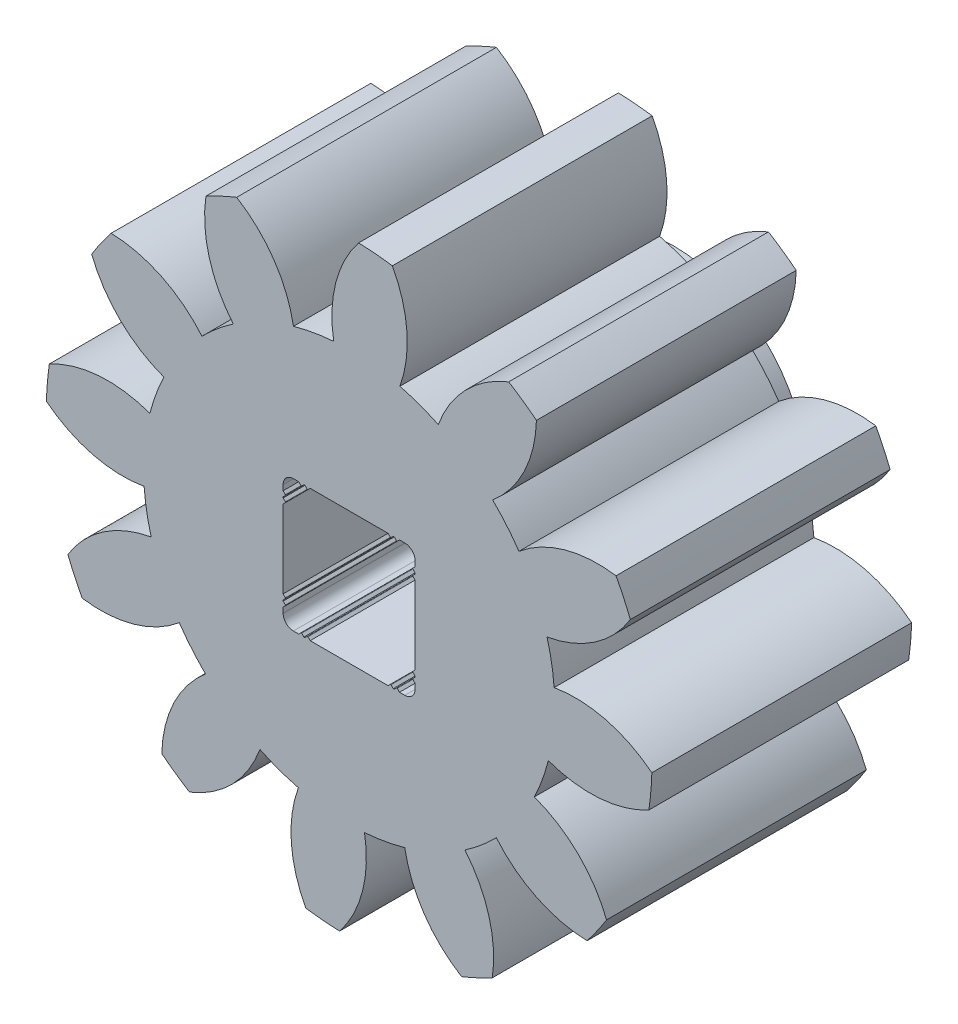
from build123d import *

# Parameters (mm, degrees)
SKETCH1_W            = 7.404
SKETCH1_H            = 6.35
CUT_EXTRUDE1_DEPTH   = 13.245853666
CUT_EXTRUDE2_DEPTH   = 13.245853666
CUT_EXTRUDE3_DEPTH   = 13.245853666
CUT_EXTRUDE4_DEPTH   = 13.245853666
CUT_EXTRUDE5_DEPTH   = 13.245853666
CUT_EXTRUDE6_DEPTH   = 13.245853666
CUT_EXTRUDE7_DEPTH   = 13.245853666
CUT_EXTRUDE8_DEPTH   = 13.245853666
CUT_EXTRUDE9_DEPTH   = 13.243663808
CUT_EXTRUDE10_DEPTH  = 13.243663808
CUT_EXTRUDE11_DEPTH  = 13.243663808
CUT_EXTRUDE12_DEPTH  = 13.241473559
SKETCH15_R           = 3.25
BOSS_EXTRUDE2_DEPTH  = 1.5875
CUT_EXTRUDE13_DEPTH  = 14.135260985
FILLET1_R            = 0.0127
CHAMFER1_SIZE        = 0.017960512
CHAMFER2_SIZE        = 0.017990274
CHAMFER2_PART_2_SIZE = 0.017990274
CHAMFER2_PART_3_SIZE = 0.017990274
CHAMFER2_PART_4_SIZE = 0.017990274
FILLET2_R            = 0.25


with BuildPart() as part:
    # Sketch1 → Revolve1 (revolve)
    with BuildSketch(Plane(origin=(0, 0, 0), x_dir=(1, 0, 0), z_dir=(0, 1, 0))):
        with Locations((3.702, 0)):
            Rectangle(SKETCH1_W, SKETCH1_H)
    revolve(axis=Axis((0, 0, -3.175), (0, 0, 1)))

    # Sketch2 → Cut-Extrude1 (cut, through all)
    with BuildSketch(Plane(origin=(0, 0, -3.175), x_dir=(-1, 0, 0), z_dir=(0, 0, -1))):
        with BuildLine():
            ThreePointArc((1.057001873, -7.328162323), (2.532317141, -6.957484164), (3.900741532, -6.293125734))
            ThreePointArc((3.900741532, -6.293125734), (2.850773823, -5.595435975), (2.180140266, -4.527983952))
            ThreePointArc((2.180140266, -4.527983952), (1.71882223, -4.722425266), (1.240447645, -4.870004095))
            ThreePointArc((1.240447645, -4.870004095), (1.41285747, -6.118794727), (1.057001873, -7.328162323))
        make_face()
    extrude(amount=-CUT_EXTRUDE1_DEPTH, mode=Mode.SUBTRACT)

    # Sketch3 → Cut-Extrude2 (cut, through all)
    with BuildSketch(Plane(origin=(0, 0, -3.175), x_dir=(-1, 0, 0), z_dir=(0, 0, -1))):
        with BuildLine():
            ThreePointArc((-2.748690687, -6.874875672), (-1.285691107, -7.291516603), (0.231578393, -7.400377521))
            ThreePointArc((0.231578393, -7.400377521), (-0.328875436, -6.271176611), (-0.375935122, -5.011419263))
            ThreePointArc((-0.375935122, -5.011419263), (-0.872668917, -4.949151363), (-1.360742875, -4.837771086))
            ThreePointArc((-1.360742875, -4.837771086), (-1.835826903, -6.005460409), (-2.748690687, -6.874875672))
        make_face()
    extrude(amount=-CUT_EXTRUDE2_DEPTH, mode=Mode.SUBTRACT)

    # Sketch4 → Cut-Extrude3 (cut, through all)
    with BuildSketch(Plane(origin=(0, 0, -3.175), x_dir=(-1, 0, 0), z_dir=(0, 0, -1))):
        with BuildLine():
            ThreePointArc((-5.817873798, -4.579471636), (-4.759199462, -5.671793057), (-3.499635989, -6.524704127))
            ThreePointArc((-3.499635989, -6.524704127), (-3.420402788, -5.266560539), (-2.831278997, -4.15204883))
            ThreePointArc((-2.831278997, -4.15204883), (-3.230329132, -3.849756349), (-3.597323441, -3.509261221))
            ThreePointArc((-3.597323441, -3.509261221), (-4.592602939, -4.282967824), (-5.817873798, -4.579471636))
        make_face()
    extrude(amount=-CUT_EXTRUDE3_DEPTH, mode=Mode.SUBTRACT)

    # Sketch5 → Cut-Extrude4 (cut, through all)
    with BuildSketch(Plane(origin=(0, 0, -3.175), x_dir=(-1, 0, 0), z_dir=(0, 0, -1))):
        with BuildLine():
            ThreePointArc((-7.328162323, -1.057001873), (-6.957484164, -2.532317141), (-6.293125734, -3.900741532))
            ThreePointArc((-6.293125734, -3.900741532), (-5.595435975, -2.850773823), (-4.527983952, -2.180140266))
            ThreePointArc((-4.527983952, -2.180140266), (-4.722425266, -1.71882223), (-4.870004095, -1.240447645))
            ThreePointArc((-4.870004095, -1.240447645), (-6.118794727, -1.41285747), (-7.328162323, -1.057001873))
        make_face()
    extrude(amount=-CUT_EXTRUDE4_DEPTH, mode=Mode.SUBTRACT)

    # Sketch6 → Cut-Extrude5 (cut, through all)
    with BuildSketch(Plane(origin=(0, 0, -3.175), x_dir=(-1, 0, 0), z_dir=(0, 0, -1))):
        with BuildLine():
            ThreePointArc((-6.874875672, 2.748690687), (-7.291516603, 1.285691107), (-7.400377521, -0.231578393))
            ThreePointArc((-7.400377521, -0.231578393), (-6.271176611, 0.328875436), (-5.011419263, 0.375935122))
            ThreePointArc((-5.011419263, 0.375935122), (-4.949151363, 0.872668917), (-4.837771086, 1.360742875))
            ThreePointArc((-4.837771086, 1.360742875), (-6.005460409, 1.835826903), (-6.874875672, 2.748690687))
        make_face()
    extrude(amount=-CUT_EXTRUDE5_DEPTH, mode=Mode.SUBTRACT)

    # Sketch7 → Cut-Extrude6 (cut, through all)
    with BuildSketch(Plane(origin=(0, 0, -3.175), x_dir=(-1, 0, 0), z_dir=(0, 0, -1))):
        with BuildLine():
            ThreePointArc((-4.579471636, 5.817873798), (-5.671793057, 4.759199462), (-6.524704127, 3.499635989))
            ThreePointArc((-6.524704127, 3.499635989), (-5.266560539, 3.420402788), (-4.15204883, 2.831278997))
            ThreePointArc((-4.15204883, 2.831278997), (-3.849756349, 3.230329132), (-3.509261221, 3.597323441))
            ThreePointArc((-3.509261221, 3.597323441), (-4.282967824, 4.592602939), (-4.579471636, 5.817873798))
        make_face()
    extrude(amount=-CUT_EXTRUDE6_DEPTH, mode=Mode.SUBTRACT)

    # Sketch8 → Cut-Extrude7 (cut, through all)
    with BuildSketch(Plane(origin=(0, 0, -3.175), x_dir=(-1, 0, 0), z_dir=(0, 0, -1))):
        with BuildLine():
            ThreePointArc((-1.057001873, 7.328162323), (-2.532317141, 6.957484164), (-3.900741532, 6.293125734))
            ThreePointArc((-3.900741532, 6.293125734), (-2.850773823, 5.595435975), (-2.180140266, 4.527983952))
            ThreePointArc((-2.180140266, 4.527983952), (-1.71882223, 4.722425266), (-1.240447645, 4.870004095))
            ThreePointArc((-1.240447645, 4.870004095), (-1.41285747, 6.118794727), (-1.057001873, 7.328162323))
        make_face()
    extrude(amount=-CUT_EXTRUDE7_DEPTH, mode=Mode.SUBTRACT)

    # Sketch9 → Cut-Extrude8 (cut, through all)
    with BuildSketch(Plane(origin=(0, 0, -3.175), x_dir=(-1, 0, 0), z_dir=(0, 0, -1))):
        with BuildLine():
            ThreePointArc((2.748690687, 6.874875672), (1.285691107, 7.291516603), (-0.231578393, 7.400377521))
            ThreePointArc((-0.231578393, 7.400377521), (0.328875436, 6.271176611), (0.375935122, 5.011419263))
            ThreePointArc((0.375935122, 5.011419263), (0.872668917, 4.949151363), (1.360742875, 4.837771086))
            ThreePointArc((1.360742875, 4.837771086), (1.835826903, 6.005460409), (2.748690687, 6.874875672))
        make_face()
    extrude(amount=-CUT_EXTRUDE8_DEPTH, mode=Mode.SUBTRACT)

    # Sketch10 → Cut-Extrude9 (cut, through all)
    with BuildSketch(Plane(origin=(0, 0, -3.175), x_dir=(-1, 0, 0), z_dir=(0, 0, -1))):
        with BuildLine():
            ThreePointArc((5.817873798, 4.579471636), (4.759199462, 5.671793057), (3.499635989, 6.524704127))
            ThreePointArc((3.499635989, 6.524704127), (3.420402788, 5.266560539), (2.831278997, 4.15204883))
            ThreePointArc((2.831278997, 4.15204883), (3.230329132, 3.849756349), (3.597323441, 3.509261221))
            ThreePointArc((3.597323441, 3.509261221), (4.592602939, 4.282967824), (5.817873798, 4.579471636))
        make_face()
    extrude(amount=-CUT_EXTRUDE9_DEPTH, mode=Mode.SUBTRACT)

    # Sketch11 → Cut-Extrude10 (cut, through all)
    with BuildSketch(Plane(origin=(0, 0, -3.175), x_dir=(-1, 0, 0), z_dir=(0, 0, -1))):
        with BuildLine():
            ThreePointArc((7.328162323, 1.057001873), (6.957484164, 2.532317141), (6.293125734, 3.900741532))
            ThreePointArc((6.293125734, 3.900741532), (5.595435975, 2.850773823), (4.527983952, 2.180140266))
            ThreePointArc((4.527983952, 2.180140266), (4.722425266, 1.71882223), (4.870004095, 1.240447645))
            ThreePointArc((4.870004095, 1.240447645), (6.118794727, 1.41285747), (7.328162323, 1.057001873))
        make_face()
    extrude(amount=-CUT_EXTRUDE10_DEPTH, mode=Mode.SUBTRACT)

    # Sketch12 → Cut-Extrude11 (cut, through all)
    with BuildSketch(Plane(origin=(0, 0, -3.175), x_dir=(-1, 0, 0), z_dir=(0, 0, -1))):
        with BuildLine():
            ThreePointArc((6.874875672, -2.748690687), (7.291516603, -1.285691107), (7.400377521, 0.231578393))
            ThreePointArc((7.400377521, 0.231578393), (6.271176611, -0.328875436), (5.011419263, -0.375935122))
            ThreePointArc((5.011419263, -0.375935122), (4.949151363, -0.872668917), (4.837771086, -1.360742875))
            ThreePointArc((4.837771086, -1.360742875), (6.005460409, -1.835826903), (6.874875672, -2.748690687))
        make_face()
    extrude(amount=-CUT_EXTRUDE11_DEPTH, mode=Mode.SUBTRACT)

    # Sketch13 → Cut-Extrude12 (cut, through all)
    with BuildSketch(Plane(origin=(0, 0, -3.175), x_dir=(-1, 0, 0), z_dir=(0, 0, -1))):
        with BuildLine():
            ThreePointArc((4.579471636, -5.817873798), (5.671793057, -4.759199462), (6.524704127, -3.499635989))
            ThreePointArc((6.524704127, -3.499635989), (5.266560539, -3.420402788), (4.15204883, -2.831278997))
            ThreePointArc((4.15204883, -2.831278997), (3.849756349, -3.230329132), (3.509261221, -3.597323441))
            ThreePointArc((3.509261221, -3.597323441), (4.282967824, -4.592602939), (4.579471636, -5.817873798))
        make_face()
    extrude(amount=-CUT_EXTRUDE12_DEPTH, mode=Mode.SUBTRACT)

    # Sketch15 → Boss-Extrude2 (add)
    with BuildSketch(Plane(origin=(0, 0, -3.175), x_dir=(-1, 0, 0), z_dir=(0, 0, -1))):
        Circle(SKETCH15_R)
    extrude(amount=BOSS_EXTRUDE2_DEPTH)

    # Sketch16 → Cut-Extrude13 (cut, through all)
    with BuildSketch(Plane(origin=(0, 0, -4.7625), x_dir=(-1, 0, 0), z_dir=(0, 0, -1))):
        Polygon((1.548789697, 1.168210303), (1.6125, 1.2315), (1.6125, 1.6125), (1.2315, 1.6125), (1.168, 1.549), (1.0918, 1.6252), (1.0156, 1.549), (0.9521, 1.6125), (-0.9521, 1.6125), (-1.0156, 1.548789726), (-1.0918, 1.625242055), (-1.168, 1.548789726), (-1.2315, 1.6125), (-1.6125, 1.6125), (-1.6125, 1.2315), (-1.548789726, 1.168), (-1.625242055, 1.0918), (-1.548789726, 1.0156), (-1.6125, 0.9521), (-1.6125, -0.9521), (-1.549, -1.0156), (-1.6252, -1.0918), (-1.548789697, -1.168210303), (-1.6125, -1.2315), (-1.6125, -1.6125), (-1.2315, -1.6125), (-1.168, -1.549), (-1.0918, -1.6252), (-1.0156, -1.549), (-0.9521, -1.6125), (0.9521, -1.6125), (1.0156, -1.548789726), (1.0918, -1.625242055), (1.168, -1.548789726), (1.2315, -1.6125), (1.6125, -1.6125), (1.6125, -1.2315), (1.548789726, -1.168), (1.625242055, -1.0918), (1.548789726, -1.0156), (1.6125, -0.9521), (1.6125, 0.9521), (1.549, 1.0156), (1.6252, 1.0918), align=None)
    extrude(amount=-CUT_EXTRUDE13_DEPTH, mode=Mode.SUBTRACT)

    # Fillet1
    fillet1_edges = [part.edges().sort_by_distance(p)[0] for p in [
        (1.168, -1.549, -0.79375),
        (-1.168, 1.549, -0.79375),
        (1.548789726, 1.0156, -0.79375),
        (1.548789726, 1.168, -0.79375),
        (-1.0156, 1.549, -0.79375),
        (1.168, 1.548789726, -0.79375),
        (1.548789697, -1.168210303, -0.79375),
        (-1.168, -1.548789726, -0.79375),
        (1.0156, 1.548789726, -0.79375),
        (-1.0156, -1.548789726, -0.79375),
        (1.549, -1.0156, -0.79375),
        (1.0156, -1.549, -0.79375),
        (-1.548789726, -1.0156, -0.79375),
        (-1.549, 1.0156, -0.79375),
        (-1.548789697, 1.168210303, -0.79375),
        (-1.548789726, -1.168, -0.79375),
    ]]
    fillet(fillet1_edges, radius=FILLET1_R)

    # Chamfer1
    chamfer1_edges = [part.edges().sort_by_distance(p)[0] for p in [
        (1.0918, -1.6252, -0.79375),
        (-1.0918, 1.6252, -0.79375),
        (1.6252, -1.0918, -0.79375),
        (-1.6252, 1.0918, -0.79375),
    ]]
    chamfer(chamfer1_edges, length=CHAMFER1_SIZE)

    # Chamfer2
    chamfer2_edges = [part.edges().sort_by_distance(p)[0] for p in [
        (1.625242055, 1.0918, -0.79375),
    ]]
    chamfer(chamfer2_edges, length=CHAMFER2_SIZE)

    # Chamfer2 part 2
    chamfer2_part_2_edges = [part.edges().sort_by_distance(p)[0] for p in [
        (-1.0918, -1.625242055, -0.79375),
    ]]
    chamfer(chamfer2_part_2_edges, length=CHAMFER2_PART_2_SIZE)

    # Chamfer2 part 3
    chamfer2_part_3_edges = [part.edges().sort_by_distance(p)[0] for p in [
        (-1.625242055, -1.0918, -0.79375),
    ]]
    chamfer(chamfer2_part_3_edges, length=CHAMFER2_PART_3_SIZE)

    # Chamfer2 part 4
    chamfer2_part_4_edges = [part.edges().sort_by_distance(p)[0] for p in [
        (1.0918, 1.625242055, -0.79375),
    ]]
    chamfer(chamfer2_part_4_edges, length=CHAMFER2_PART_4_SIZE)

    # Fillet2
    fillet2_edges = [part.edges().sort_by_distance(p)[0] for p in [
        (-1.6125, -1.6125, -0.79375),
        (1.6125, 1.6125, -0.79375),
        (-1.6125, 1.6125, -0.79375),
        (1.6125, -1.6125, -0.79375),
    ]]
    fillet(fillet2_edges, radius=FILLET2_R)


solid = part.part
